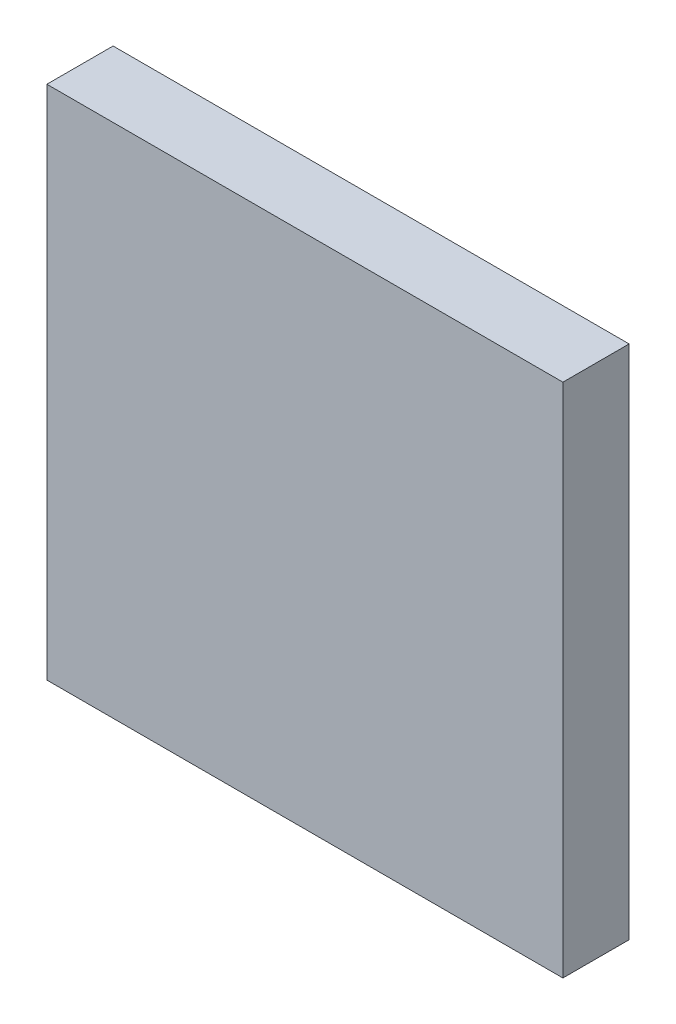
from build123d import *

# Parameters (mm, degrees)
SKETCH_1_W       = 100
SKETCH_1_H       = 100
EXTRUDE_1_DEPTH  = 1.6
SKETCH_4_W       = 17.78
SKETCH_4_H       = 2.5
SKETCH_4_W_2     = 2.5
SKETCH_4_H_2     = 17.78
EXTRUDE_2_DEPTH  = 2.5
SKETCH_5_W       = 0.64
SKETCH_5_H       = 0.64
EXTRUDE_3_DEPTH  = 6.1
SKETCH_6_W       = 3.48
SKETCH_6_H       = 3.48
EXTRUDE_4_DEPTH  = 2
SKETCH_7_W       = 2
SKETCH_7_H       = 4
SKETCH_7_W_2     = 4
SKETCH_7_H_2     = 2
EXTRUDE_5_DEPTH  = 1.1
SKETCH_8_W       = 15.2
SKETCH_8_H       = 7.4
EXTRUDE_6_DEPTH  = 2.65
SKETCH_9_W       = 7.62
SKETCH_9_H       = 2.5
EXTRUDE_7_DEPTH  = 2.5
SKETCH_11_W      = 0.64
SKETCH_11_H      = 0.64
EXTRUDE_8_DEPTH  = 6.1
EXTRUDE_9_DEPTH  = 6
SKETCH_14_R      = 1
SKETCH_14_W      = 7.62
SKETCH_14_H      = 2.5
EXTRUDE_10_DEPTH = 2
SKETCH_15_W      = 120
SKETCH_15_H      = 120
EXTRUDE_11_DEPTH = 15.4


with BuildPart() as part:
    # ｽｹｯﾁ1 → ﾎﾞｽ - 押し出し1 (new body)
    with BuildSketch(Plane.XY):
        Rectangle(SKETCH_1_W, SKETCH_1_H)
    extrude(amount=EXTRUDE_1_DEPTH)

    # ｽｹｯﾁ4 → ﾎﾞｽ - 押し出し2 (add)
    with BuildSketch(Plane(origin=(0, 0, 0), x_dir=(-1, 0, 0), z_dir=(0, 0, -1))):
        with Locations((20, -42.6)):
            Rectangle(SKETCH_4_W, SKETCH_4_H)
        with Locations((-42.6, -20)):
            Rectangle(SKETCH_4_W_2, SKETCH_4_H_2)
        with Locations((-20, 42.6)):
            Rectangle(SKETCH_4_W, SKETCH_4_H)
        with Locations((42.6, 20)):
            Rectangle(SKETCH_4_W_2, SKETCH_4_H_2)
    extrude(amount=EXTRUDE_2_DEPTH)

    # ｽｹｯﾁ5 → ﾎﾞｽ - 押し出し3 (add)
    with BuildSketch(Plane(origin=(0, 0, -2.5), x_dir=(-1, 0, 0), z_dir=(0, 0, -1))):
        with Locations((-20, 42.6)):
            Rectangle(SKETCH_5_W, SKETCH_5_H)
        with Locations((-17.46, 42.6)):
            Rectangle(SKETCH_5_W, SKETCH_5_H)
        with Locations((-14.92, 42.6)):
            Rectangle(SKETCH_5_W, SKETCH_5_H)
        with Locations((-12.38, 42.6)):
            Rectangle(SKETCH_5_W, SKETCH_5_H)
        with Locations((-22.54, 42.6)):
            Rectangle(SKETCH_5_W, SKETCH_5_H)
        with Locations((-25.08, 42.6)):
            Rectangle(SKETCH_5_W, SKETCH_5_H)
        with Locations((-27.62, 42.6)):
            Rectangle(SKETCH_5_W, SKETCH_5_H)
        with Locations((-42.6, -20)):
            Rectangle(SKETCH_5_W, SKETCH_5_H)
        with Locations((-42.6, -22.54)):
            Rectangle(SKETCH_5_W, SKETCH_5_H)
        with Locations((42.6, 20)):
            Rectangle(SKETCH_5_W, SKETCH_5_H)
        with Locations((-42.6, -25.08)):
            Rectangle(SKETCH_5_W, SKETCH_5_H)
        with Locations((-42.6, -27.62)):
            Rectangle(SKETCH_5_W, SKETCH_5_H)
        with Locations((-42.6, -17.46)):
            Rectangle(SKETCH_5_W, SKETCH_5_H)
        with Locations((-42.6, -14.92)):
            Rectangle(SKETCH_5_W, SKETCH_5_H)
        with Locations((-42.6, -12.38)):
            Rectangle(SKETCH_5_W, SKETCH_5_H)
        with Locations((42.6, 17.46)):
            Rectangle(SKETCH_5_W, SKETCH_5_H)
        with Locations((42.6, 14.92)):
            Rectangle(SKETCH_5_W, SKETCH_5_H)
        with Locations((42.6, 12.38)):
            Rectangle(SKETCH_5_W, SKETCH_5_H)
        with Locations((42.6, 22.54)):
            Rectangle(SKETCH_5_W, SKETCH_5_H)
        with Locations((42.6, 25.08)):
            Rectangle(SKETCH_5_W, SKETCH_5_H)
        with Locations((42.6, 27.62)):
            Rectangle(SKETCH_5_W, SKETCH_5_H)
        with Locations((20, -42.6)):
            Rectangle(SKETCH_5_W, SKETCH_5_H)
        with Locations((17.46, -42.6)):
            Rectangle(SKETCH_5_W, SKETCH_5_H)
        with Locations((14.92, -42.6)):
            Rectangle(SKETCH_5_W, SKETCH_5_H)
        with Locations((12.38, -42.6)):
            Rectangle(SKETCH_5_W, SKETCH_5_H)
        with Locations((22.54, -42.6)):
            Rectangle(SKETCH_5_W, SKETCH_5_H)
        with Locations((25.08, -42.6)):
            Rectangle(SKETCH_5_W, SKETCH_5_H)
        with Locations((27.62, -42.6)):
            Rectangle(SKETCH_5_W, SKETCH_5_H)
    extrude(amount=EXTRUDE_3_DEPTH)

    # ｽｹｯﾁ6 → ﾎﾞｽ - 押し出し4 (add)
    with BuildSketch(Plane.XY.offset(1.6)):
        with Locations((-35, -35)):
            Rectangle(SKETCH_6_W, SKETCH_6_H)
        with Locations((-35, 35)):
            Rectangle(SKETCH_6_W, SKETCH_6_H)
        with Locations((35, -35)):
            Rectangle(SKETCH_6_W, SKETCH_6_H)
        with Locations((35, 35)):
            Rectangle(SKETCH_6_W, SKETCH_6_H)
    extrude(amount=EXTRUDE_4_DEPTH)

    # ｽｹｯﾁ7 → ﾎﾞｽ - 押し出し5 (add)
    with BuildSketch(Plane.XY.offset(1.6)):
        with Locations((-37.5, 0)):
            Rectangle(SKETCH_7_W, SKETCH_7_H)
        with Locations((37.5, 0)):
            Rectangle(SKETCH_7_W, SKETCH_7_H)
        with Locations((0, 37.5)):
            Rectangle(SKETCH_7_W_2, SKETCH_7_H_2)
        with Locations((0, -37.5)):
            Rectangle(SKETCH_7_W_2, SKETCH_7_H_2)
        Rectangle(SKETCH_7_W, SKETCH_7_H)
    extrude(amount=EXTRUDE_5_DEPTH)

    # ｽｹｯﾁ8 → ﾎﾞｽ - 押し出し6 (add)
    with BuildSketch(Plane.XY.offset(1.6)):
        with Locations((0, -17)):
            Rectangle(SKETCH_8_W, SKETCH_8_H)
    extrude(amount=EXTRUDE_6_DEPTH)

    # ｽｹｯﾁ9 → ﾎﾞｽ - 押し出し7 (add)
    with BuildSketch(Plane(origin=(0, 0, 0), x_dir=(-1, 0, 0), z_dir=(0, 0, -1))):
        with Locations((-0.8, 18.58)):
            Rectangle(SKETCH_9_W, SKETCH_9_H)
    extrude(amount=EXTRUDE_7_DEPTH)

    # ｽｹｯﾁ11 → ﾎﾞｽ - 押し出し8 (add)
    with BuildSketch(Plane(origin=(0, 0, -2.5), x_dir=(-1, 0, 0), z_dir=(0, 0, -1))):
        with Locations((-0.8, 18.58)):
            Rectangle(SKETCH_11_W, SKETCH_11_H)
        with Locations((-3.34, 18.58)):
            Rectangle(SKETCH_11_W, SKETCH_11_H)
        with Locations((1.74, 18.58)):
            Rectangle(SKETCH_11_W, SKETCH_11_H)
    extrude(amount=EXTRUDE_8_DEPTH)

    # ｽｹｯﾁ13 → ﾎﾞｽ - 押し出し9 (add)
    with BuildSketch(Plane(origin=(0, 0, 0), x_dir=(-1, 0, 0), z_dir=(0, 0, -1))):
        Polygon((32, -30), (31, -28.267949192), (29, -28.267949192), (28, -30), (29, -31.732050808), (31, -31.732050808), align=None)
        Polygon((-28, -30), (-29, -28.267949192), (-31, -28.267949192), (-32, -30), (-31, -31.732050808), (-29, -31.732050808), align=None)
        Polygon((32, 30), (31, 31.732050808), (29, 31.732050808), (28, 30), (29, 28.267949192), (31, 28.267949192), align=None)
        Polygon((-28, 30), (-29, 31.732050808), (-31, 31.732050808), (-32, 30), (-31, 28.267949192), (-29, 28.267949192), align=None)
    extrude(amount=EXTRUDE_9_DEPTH)


with BuildPart() as body_2:
    # ｽｹｯﾁ14 → ﾎﾞｽ - 押し出し10 (new body)
    with BuildSketch(Plane(origin=(0, 0, -6), x_dir=(-1, 0, 0), z_dir=(0, 0, -1))):
        Polygon((0, -39), (0, -41), (39, -41), (39, 0), (41, 0), (41, 39), (0, 39), (0, 41), (-39, 41), (-39, 0), (-41, 0), (-41, -39), align=None)
        with Locations((-30, 30)):
            Circle(SKETCH_14_R, mode=Mode.SUBTRACT)
        with Locations((30, 30)):
            Circle(SKETCH_14_R, mode=Mode.SUBTRACT)
        with Locations((30, -30)):
            Circle(SKETCH_14_R, mode=Mode.SUBTRACT)
        with Locations((-30, -30)):
            Circle(SKETCH_14_R, mode=Mode.SUBTRACT)
        with Locations((-0.8, 18.58)):
            Rectangle(SKETCH_14_W, SKETCH_14_H, mode=Mode.SUBTRACT)
    extrude(amount=EXTRUDE_10_DEPTH)


with BuildPart() as body_3:
    # ｽｹｯﾁ15 → ﾎﾞｽ - 押し出し11 (new body)
    with BuildSketch(Plane(origin=(0, 0, -2.5), x_dir=(-1, 0, 0), z_dir=(0, 0, -1))):
        Rectangle(SKETCH_15_W, SKETCH_15_H)
    extrude(amount=-EXTRUDE_11_DEPTH)


solid = Compound([part.part, body_2.part, body_3.part])
